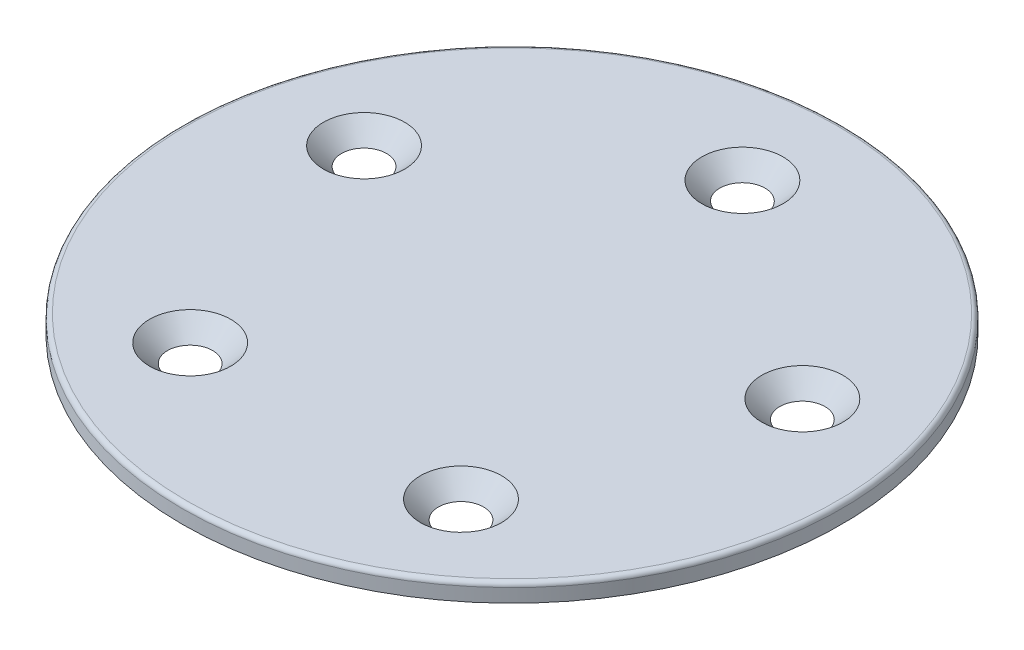
from build123d import *

# Parameters (mm, degrees)
SKETCH2_R           = 36.5
SKETCH2_R_2         = 2.5
BOSS_EXTRUDE1_DEPTH = 2
CHAMFER1_SIZE       = 2
FILLET1_R           = 0.5


with BuildPart() as part:
    # Sketch2 → Boss-Extrude1 (new body)
    with BuildSketch(Plane(origin=(0, 0, 0), x_dir=(1, 0, 0), z_dir=(0, 1, 0))):
        with Locations(Location((0, 0, 0), (0, 0, 270))):
            Circle(SKETCH2_R)
        with Locations(Location((0, 25.52, 0), (0, 0, 270))):
            Circle(SKETCH2_R_2, mode=Mode.SUBTRACT)
        with Locations(Location((24.270962296, 7.886113696, 0), (0, 0, 270))):
            Circle(SKETCH2_R_2, mode=Mode.SUBTRACT)
        with Locations(Location((15.000279639, -20.646113696, 0), (0, 0, 270))):
            Circle(SKETCH2_R_2, mode=Mode.SUBTRACT)
        with Locations(Location((-15.000279639, -20.646113696, 0), (0, 0, 270))):
            Circle(SKETCH2_R_2, mode=Mode.SUBTRACT)
        with Locations(Location((-24.270962296, 7.886113696, 0), (0, 0, 270))):
            Circle(SKETCH2_R_2, mode=Mode.SUBTRACT)
    extrude(amount=BOSS_EXTRUDE1_DEPTH)

    # Chamfer1
    chamfer1_edges = [part.edges().sort_by_distance(p)[0] for p in [
        (-24.270962296, 2, -10.386113696),
        (-15.000279639, 2, 18.146113696),
        (15.000279639, 2, 18.146113696),
        (24.270962296, 2, -10.386113696),
        (0, 2, -28.02),
    ]]
    chamfer(chamfer1_edges, length=CHAMFER1_SIZE - 0.0001)  # a hair under: the kernel refuses the full size

    # Fillet1
    fillet1_edges = [part.edges().sort_by_distance(p)[0] for p in [
        (0, 2, -36.5),
    ]]
    fillet(fillet1_edges, radius=FILLET1_R)


solid = part.part
